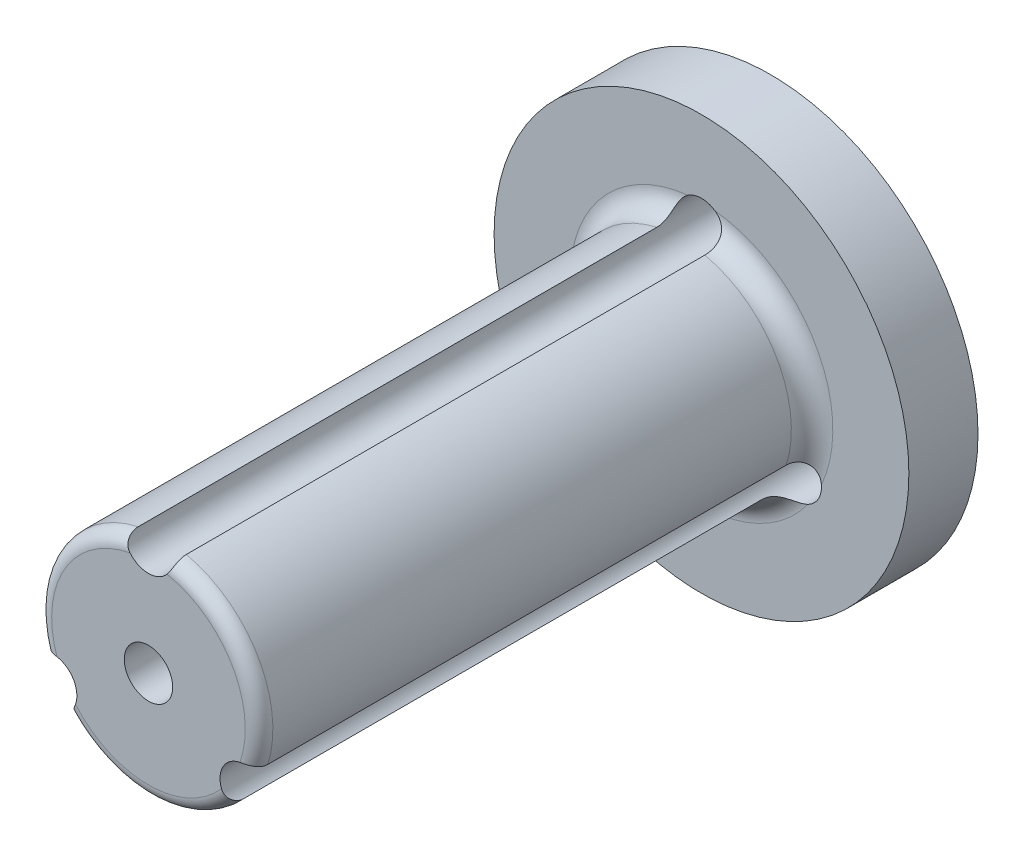
from build123d import *

# Parameters (mm, degrees)
SKETCH_1_R          = 15
EXTRUDE_1_DEPTH     = 5
SKETCH_2_R          = 8
EXTRUDE_2_DEPTH     = 40
SKETCH_3_R          = 1.75
CUT_EXTRUDE_1_DEPTH = 49
FILLET_1_R          = 1.5
FILLET_2_R          = 1


with BuildPart() as part:
    # 草图1 → 凸台-拉伸1 (new body)
    with BuildSketch(Plane.XY):
        Circle(SKETCH_1_R)
    extrude(amount=EXTRUDE_1_DEPTH)

    # 草图2 → 凸台-拉伸2 (add)
    with BuildSketch(Plane.XY.offset(5)):
        Circle(SKETCH_2_R)
    extrude(amount=EXTRUDE_2_DEPTH)

    # 草图3 → 切除-拉伸1 (cut)
    with BuildSketch(Plane(origin=(0, 0, 0), x_dir=(-1, 0, 0), z_dir=(0, 0, -1))):
        with Locations((0, 8)):
            Circle(SKETCH_3_R)
        Circle(SKETCH_3_R)
        with Locations((6.92820323, -4)):
            Circle(SKETCH_3_R)
        with Locations((-6.92820323, -4)):
            Circle(SKETCH_3_R)
    extrude(amount=-CUT_EXTRUDE_1_DEPTH, mode=Mode.SUBTRACT)

    # 圆角1
    # the kernel refuses this fillet: 1.5 mm, written as the material it adds along each edge
    with BuildSketch(Plane(origin=(0, 0, 5), x_dir=(0.24718186036796463, 0.968969105753652, 0), z_dir=(0.968969105753652, -0.24718186036796463, 0))) as fillet_1_piece_1_section:
        with BuildLine():
            CenterArc((8 + FILLET_1_R, FILLET_1_R), FILLET_1_R, 180, 90)
            Line((8, FILLET_1_R), (8, 0))
            Line((8, 0), (8 + FILLET_1_R, 0))
        make_face()
    fillet_1_piece_1 = revolve(axis=Axis((0, 0, 5), (0, 0, 1)), revolution_arc=148.621623282, mode=Mode.PRIVATE)
    fillet_1_piece_1 = fillet_1_piece_1 - Plane(origin=(-6.92820323, -4, 5.2649635), x_dir=(-1, 0, 0), z_dir=(0, 0, -1)) * Cylinder(1.75, 39, mode=Mode.PRIVATE)
    fillet_1_piece_1 = fillet_1_piece_1 - Plane(origin=(0, 8, 5.2649635), x_dir=(-1, 0, 0), z_dir=(0, 0, -1)) * Cylinder(1.75, 39, mode=Mode.PRIVATE)
    add(fillet_1_piece_1)
    with BuildSketch(Plane(origin=(0, 0, 5), x_dir=(-0.9627427912489371, -0.27041878244346385, 0), z_dir=(-0.27041878244346385, 0.9627427912489371, 0))) as fillet_1_piece_2_section:
        with BuildLine():
            CenterArc((8 + FILLET_1_R, FILLET_1_R), FILLET_1_R, 180, 90)
            Line((8, FILLET_1_R), (8, 0))
            Line((8, 0), (8 + FILLET_1_R, 0))
        make_face()
    fillet_1_piece_2 = revolve(axis=Axis((0, 0, 5), (0, 0, 1)), revolution_arc=148.621623282, mode=Mode.PRIVATE)
    fillet_1_piece_2 = fillet_1_piece_2 - Plane(origin=(6.92820323, -4, 5.2649635), x_dir=(-1, 0, 0), z_dir=(0, 0, -1)) * Cylinder(1.75, 39, mode=Mode.PRIVATE)
    fillet_1_piece_2 = fillet_1_piece_2 - Plane(origin=(-6.92820323, -4, 5.2649635), x_dir=(-1, 0, 0), z_dir=(0, 0, -1)) * Cylinder(1.75, 39, mode=Mode.PRIVATE)
    add(fillet_1_piece_2)
    with BuildSketch(Plane(origin=(0, 0, 5), x_dir=(-0.24718186036796455, 0.968969105753652, 0), z_dir=(-0.968969105753652, -0.24718186036796455, 0))) as fillet_1_piece_3_section:
        with BuildLine():
            CenterArc((8 + FILLET_1_R, -FILLET_1_R), FILLET_1_R, 90, 90)
            Line((8, -FILLET_1_R), (8, 0))
            Line((8, 0), (8 + FILLET_1_R, 0))
        make_face()
    fillet_1_piece_3 = revolve(axis=Axis((0, 0, 5), (0, 0, -1)), revolution_arc=148.621623282, mode=Mode.PRIVATE)
    fillet_1_piece_3 = fillet_1_piece_3 - Plane(origin=(6.92820323, -4, 5.264963506), x_dir=(-1, 0, 0), z_dir=(0, 0, -1)) * Cylinder(1.75, 39, mode=Mode.PRIVATE)
    fillet_1_piece_3 = fillet_1_piece_3 - Plane(origin=(0, 8, 5.264963506), x_dir=(-1, 0, 0), z_dir=(0, 0, -1)) * Cylinder(1.75, 39, mode=Mode.PRIVATE)
    add(fillet_1_piece_3)

    # 圆角2
    fillet_2_edges = [part.edges().sort_by_distance(p)[0] for p in [
        (-6.92820323, 4, 45),
        (0, -8, 45),
        (6.92820323, 4, 45),
    ]]
    fillet(fillet_2_edges, radius=FILLET_2_R)


solid = part.part
